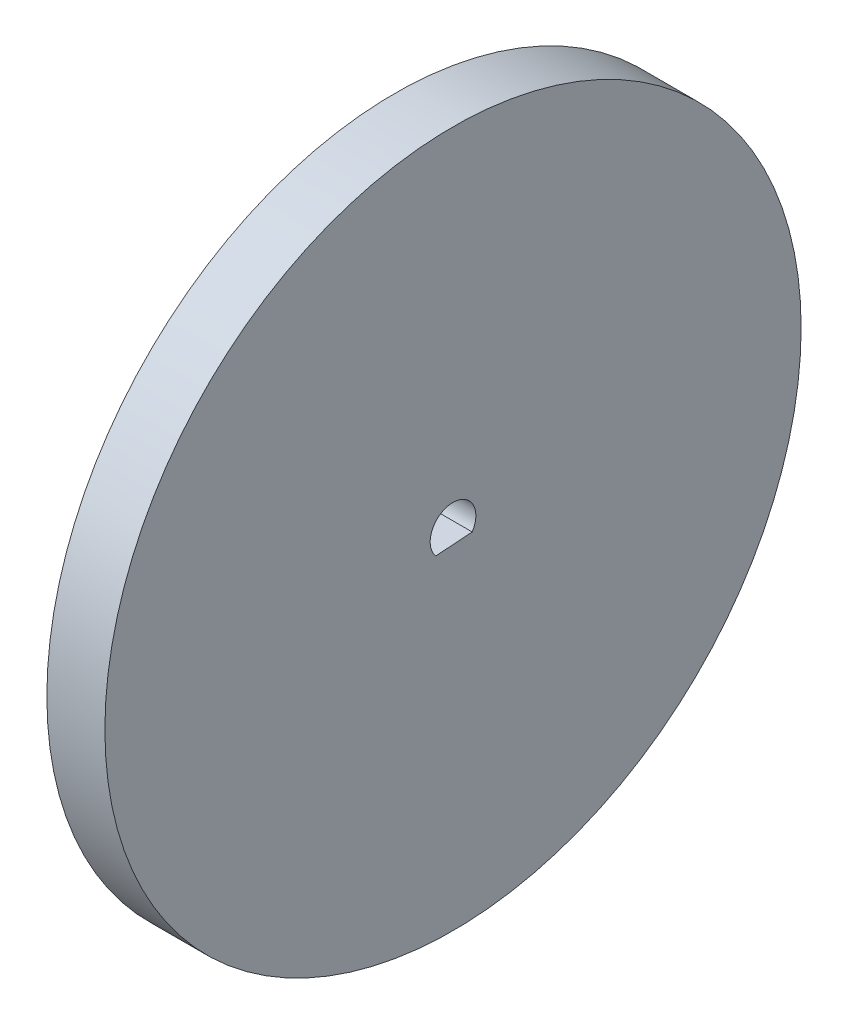
from build123d import *

# Parameters (mm, degrees)
SKETCH1_R           = 38.1
BOSS_EXTRUDE1_DEPTH = 6.35
CUT_EXTRUDE1_DEPTH  = 55.254423783


with BuildPart() as part:
    # Sketch1 → Boss-Extrude1 (new body)
    with BuildSketch(Plane(origin=(0, 0, 0), x_dir=(0, 0, -1), z_dir=(1, 0, 0))):
        Circle(SKETCH1_R)
    extrude(amount=BOSS_EXTRUDE1_DEPTH)

    # Sketch5 → Cut-Extrude1 (cut, through all)
    with BuildSketch(Plane(origin=(6.35, 0, 0), x_dir=(0, 0, -1), z_dir=(1, 0, 0))):
        with BuildLine():
            Line((-1.889315824, -1.637218897), (2.100738572, -1.3553219))
            ThreePointArc((2.100738572, -1.3553219), (-0.176185623, 2.493783998), (-1.889315824, -1.637218897))
        make_face()
    extrude(amount=-CUT_EXTRUDE1_DEPTH, mode=Mode.SUBTRACT)


solid = part.part
